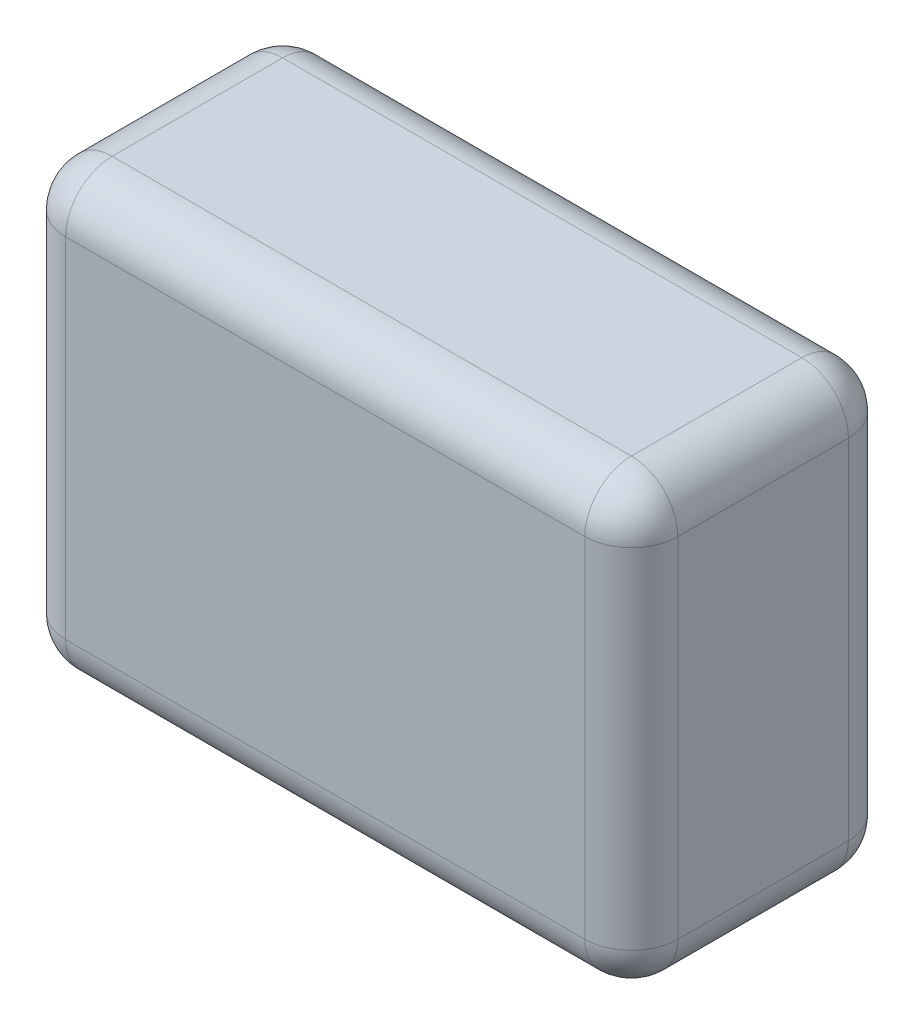
from build123d import *

# Parameters (mm, degrees)
SKETCH1_W           = 79
SKETCH1_H           = 34
BOSS_EXTRUDE1_DEPTH = 57
FILLET1_R           = 6


with BuildPart() as part:
    # Sketch1 → Boss-Extrude1 (new body)
    with BuildSketch(Plane(origin=(0, 0, 0), x_dir=(1, 0, 0), z_dir=(0, 1, 0))):
        with Locations((39.5, -17)):
            Rectangle(SKETCH1_W, SKETCH1_H)
    extrude(amount=BOSS_EXTRUDE1_DEPTH)

    # Fillet1
    fillet1_edges = [part.edges().sort_by_distance(p)[0] for p in [
        (0, 28.5, 34),
        (79, 28.5, 34),
        (79, 28.5, 0),
        (0, 28.5, 0),
        (39.5, 57, 0),
        (79, 57, 17),
        (39.5, 57, 34),
        (0, 57, 17),
        (39.5, 0, 0),
        (79, 0, 17),
        (39.5, 0, 34),
        (0, 0, 17),
    ]]
    fillet(fillet1_edges, radius=FILLET1_R)


solid = part.part
